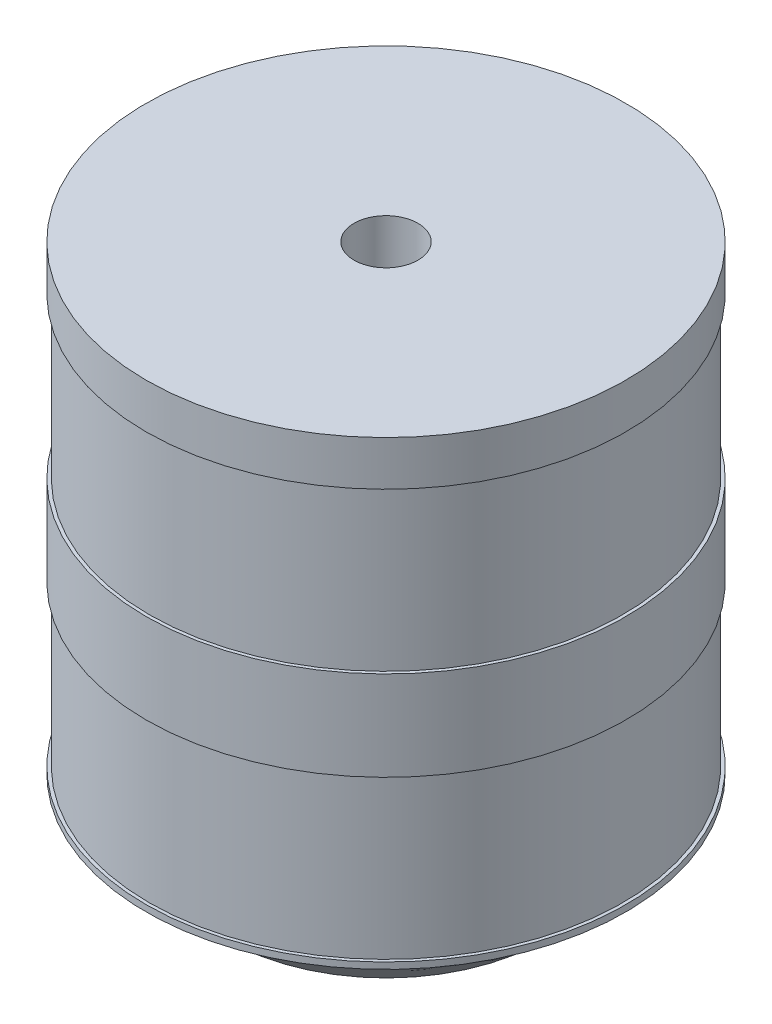
from build123d import *

# Parameters (mm, degrees)
SKETCH1_R           = 37.5
BOSS_EXTRUDE1_DEPTH = 72
CUT_EXTRUDE1_START  = -25
SKETCH3_R           = 37.5
SKETCH3_R_2         = 37
CUT_EXTRUDE1_DEPTH  = 25
CUT_EXTRUDE2_START  = -25
SKETCH2_R           = 37.5
SKETCH2_R_2         = 37
CUT_EXTRUDE2_DEPTH  = 25
SKETCH5_R           = 5
CUT_EXTRUDE3_DEPTH  = 70
SKETCH6_W           = 10
SKETCH6_H           = 40
CUT_EXTRUDE4_DEPTH  = 5


with BuildPart() as part:
    # Sketch1 → Boss-Extrude1 (new body)
    with BuildSketch(Plane(origin=(0, 0, 0), x_dir=(1, 0, 0), z_dir=(0, 1, 0))):
        with Locations(Location((0, 0, 0), (0, 0, 270))):
            Circle(SKETCH1_R)
    extrude(amount=BOSS_EXTRUDE1_DEPTH)

    # Sketch3 → Cut-Extrude1 (cut)
    with BuildSketch(Plane(origin=(0, 65, 0), x_dir=(1, 0, 0), z_dir=(0, 1, 0)).offset(CUT_EXTRUDE1_START)):
        with Locations(Location((0, 0, 0), (0, 0, 270))):
            Circle(SKETCH3_R)
        with Locations(Location((0, 0, 0), (0, 0, 270))):
            Circle(SKETCH3_R_2, mode=Mode.SUBTRACT)
    extrude(amount=CUT_EXTRUDE1_DEPTH, mode=Mode.SUBTRACT)

    # Sketch2 → Cut-Extrude2 (cut)
    with BuildSketch(Plane(origin=(0, 26, 0), x_dir=(1, 0, 0), z_dir=(0, 1, 0)).offset(CUT_EXTRUDE2_START)):
        with Locations(Location((0, 0, 0), (0, 0, 270))):
            Circle(SKETCH2_R)
        with Locations(Location((0, 0, 0), (0, 0, 270))):
            Circle(SKETCH2_R_2, mode=Mode.SUBTRACT)
    extrude(amount=CUT_EXTRUDE2_DEPTH, mode=Mode.SUBTRACT)

    # Loft2: read off the stored shape, not the designer's step
    # Loft2: loft between two sections, ruled curve by curve
    loft2_from = [
        Edge.make_bspline([(-14.77077476, -10, 20.169883812), (25.568992863, -10, 49.711433333), (55.110542384, -10, 9.371665709), (14.77077476, -10, -20.169883812), (-25.568992863, -10, -49.711433333), (-55.110542384, -10, -9.371665709), (-14.77077476, -10, 20.169883812)], [0, 0, 0, 0, 0.5, 0.5, 0.5, 1, 1, 1, 1], 3, [1, 0.333333333, 0.333333333, 1, 0.333333333, 0.333333333, 1]),
    ]
    loft2_to = [
        Edge.make_bspline([(-12.502949146, 0, 35.354296241), (58.205643335, 0, 60.360194532), (83.211541627, 0, -10.348397949), (12.502949146, 0, -35.354296241), (-58.205643335, 0, -60.360194532), (-83.211541627, 0, 10.348397949), (-12.502949146, 0, 35.354296241)], [0, 0, 0, 0, 0.5, 0.5, 0.5, 1, 1, 1, 1], 3, [1, 0.333333333, 0.333333333, 1, 0.333333333, 0.333333333, 1]),
    ]
    loft2 = Solid(Shell([*[Face.make_surface_from_curves(loft2_from[k], loft2_to[k]) for k in range(1)], Face(Wire(loft2_from)), Face(Wire(loft2_to))]))
    add(loft2)

    # Sketch5 → Cut-Extrude3 (cut)
    with BuildSketch(Plane(origin=(0, 72, 0), x_dir=(1, 0, 0), z_dir=(0, 1, 0))):
        with Locations(Location((0, 0, 0), (0, 0, 270))):
            Circle(SKETCH5_R)
    extrude(amount=-CUT_EXTRUDE3_DEPTH, mode=Mode.SUBTRACT)

    # Sketch6 → Cut-Extrude4 (cut)
    with BuildSketch(Plane.XZ.offset(10)):
        Rectangle(SKETCH6_W, SKETCH6_H)
    extrude(amount=-CUT_EXTRUDE4_DEPTH, mode=Mode.SUBTRACT)


solid = part.part
